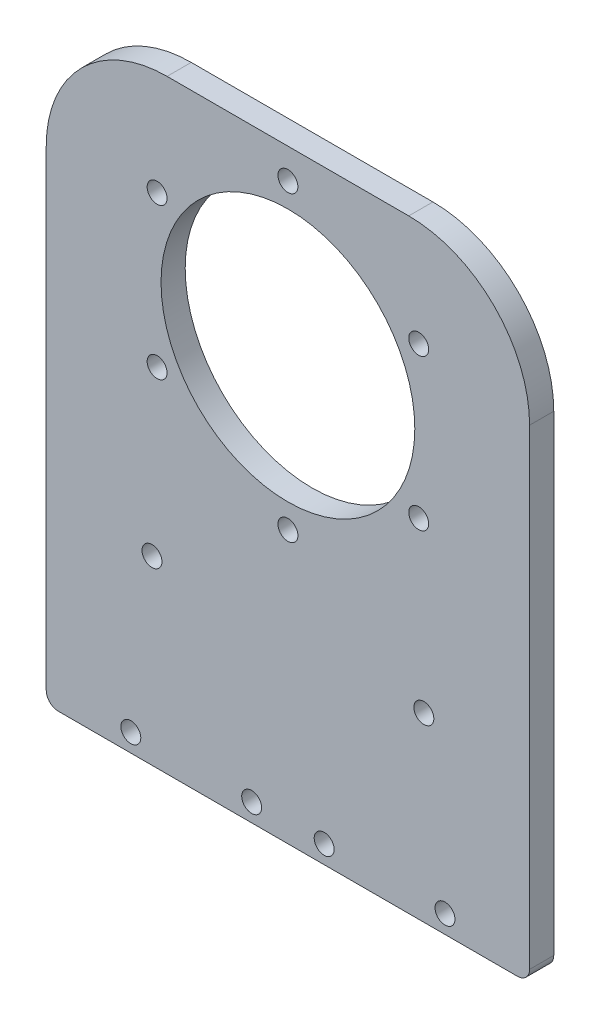
from build123d import *

# Parameters (mm, degrees)
SKETCH_1_W          = 80
SKETCH_1_H          = 100
SKETCH_1_R          = 1.65
EXTRUDE_1_DEPTH     = 4
SKETCH_3_R          = 21
CUT_EXTRUDE_2_DEPTH = 65.156059729
FILLET_1_R          = 2
SKETCH_2_R          = 1.65
CUT_EXTRUDE_1_DEPTH = 65.156059729
FILLET_2_R          = 20
SKETCH_4_R          = 1.65
CUT_EXTRUDE_3_DEPTH = 65.156059729


with BuildPart() as part:
    # 草图1 → 凸台-拉伸1 (new body)
    with BuildSketch(Plane.XY):
        Rectangle(SKETCH_1_W, SKETCH_1_H)
        with Locations((0, 45)):
            Circle(SKETCH_1_R, mode=Mode.SUBTRACT)
        with Locations((21.650635095, 32.5)):
            Circle(SKETCH_1_R, mode=Mode.SUBTRACT)
        with Locations((21.650635095, 7.5)):
            Circle(SKETCH_1_R, mode=Mode.SUBTRACT)
        with Locations((0, -5)):
            Circle(SKETCH_1_R, mode=Mode.SUBTRACT)
        with Locations((-21.650635095, 7.5)):
            Circle(SKETCH_1_R, mode=Mode.SUBTRACT)
        with Locations((-21.650635095, 32.5)):
            Circle(SKETCH_1_R, mode=Mode.SUBTRACT)
    extrude(amount=EXTRUDE_1_DEPTH)

    # 草图3 → 切除-拉伸2 (cut, through all)
    with BuildSketch(Plane.XY.offset(4)):
        with Locations((0, 20)):
            Circle(SKETCH_3_R)
    extrude(amount=-CUT_EXTRUDE_2_DEPTH, mode=Mode.SUBTRACT)

    # 圆角1
    fillet_1_edges = [part.edges().sort_by_distance(p)[0] for p in [
        (40, -50, 2),
        (-40, -50, 2),
    ]]
    fillet(fillet_1_edges, radius=FILLET_1_R)

    # 草图2 → 切除-拉伸1 (cut, through all)
    with BuildSketch(Plane.XY.offset(4)):
        with Locations((-26, -47)):
            Circle(SKETCH_2_R)
        with Locations((-6, -47)):
            Circle(SKETCH_2_R)
        with Locations((6, -47)):
            Circle(SKETCH_2_R)
        with Locations((26, -47)):
            Circle(SKETCH_2_R)
    extrude(amount=-CUT_EXTRUDE_1_DEPTH, mode=Mode.SUBTRACT)

    # 圆角2
    fillet_2_edges = [part.edges().sort_by_distance(p)[0] for p in [
        (40, 50, 2),
        (-40, 50, 2),
    ]]
    fillet(fillet_2_edges, radius=FILLET_2_R)

    # 草图4 → 切除-拉伸3 (cut, through all)
    with BuildSketch(Plane.XY.offset(4)):
        with Locations((-22.5, -20)):
            Circle(SKETCH_4_R)
        with Locations((-22.5, 60)):
            Circle(SKETCH_4_R)
        with Locations((22.5, -20)):
            Circle(SKETCH_4_R)
        with Locations((22.5, 60)):
            Circle(SKETCH_4_R)
    extrude(amount=-CUT_EXTRUDE_3_DEPTH, mode=Mode.SUBTRACT)


solid = part.part
